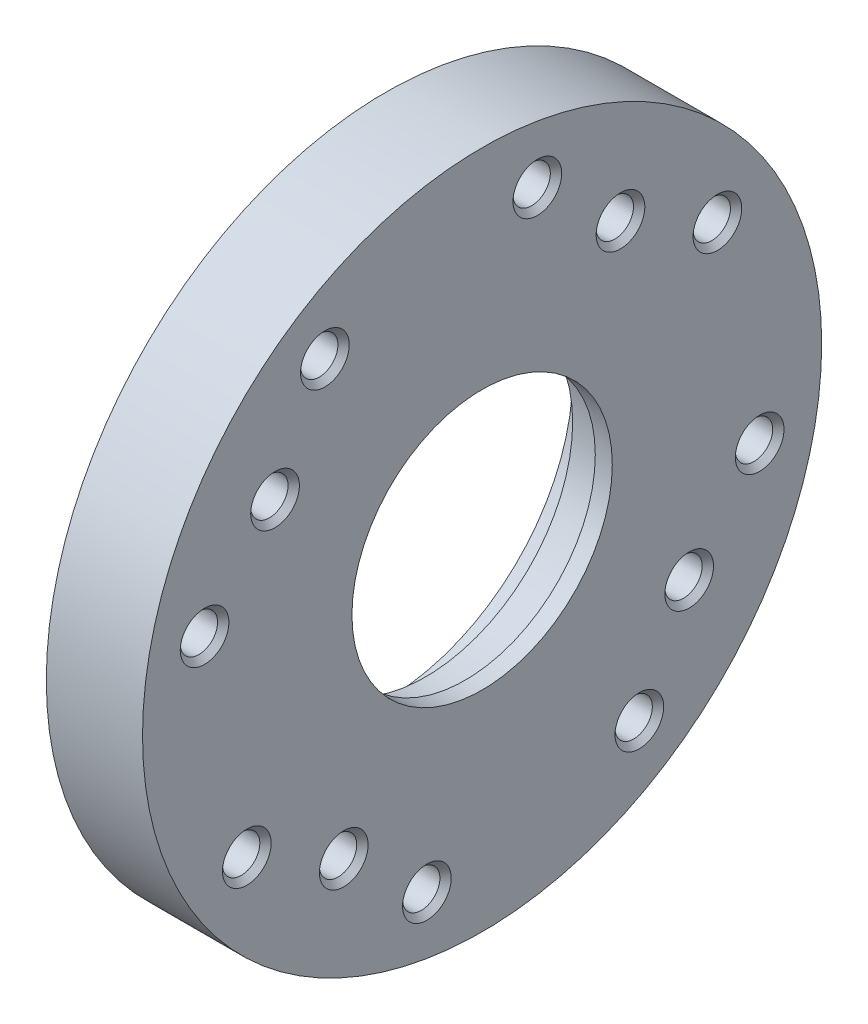
from build123d import *

# Parameters (mm, degrees)
SKETCH2_R          = 2.5
CUT_EXTRUDE1_DEPTH = 4
SKETCH3_R          = 3
CUT_EXTRUDE4_DEPTH = 87.539008545
SKETCH5_R          = 3.3
CUT_EXTRUDE6_DEPTH = 10
CHAMFER1_SIZE      = 1


with BuildPart() as part:
    # Sketch1 → Revolve1 (revolve)
    with BuildSketch(Plane.XY):
        Polygon((0, 60), (0, 33), (7, 33), (7, 26), (14, 26), (14, 23), (17, 23), (17, 60), align=None)
    revolve(axis=Axis((0, 0, 0), (1, 0, 0)))

    # Sketch2 → Cut-Extrude1 (cut)
    with BuildSketch(Plane.ZY):
        with Locations((0, 40)):
            Circle(SKETCH2_R)
        with Locations((15.307337295, 36.9551813)):
            Circle(SKETCH2_R)
        with Locations((28.284271247, 28.284271247)):
            Circle(SKETCH2_R)
        with Locations((36.9551813, 15.307337295)):
            Circle(SKETCH2_R)
        with Locations((40, 0)):
            Circle(SKETCH2_R)
        with Locations((36.9551813, -15.307337295)):
            Circle(SKETCH2_R)
        with Locations((28.284271247, -28.284271247)):
            Circle(SKETCH2_R)
        with Locations((15.307337295, -36.9551813)):
            Circle(SKETCH2_R)
        with Locations((0, -40)):
            Circle(SKETCH2_R)
        with Locations((-15.307337295, -36.9551813)):
            Circle(SKETCH2_R)
        with Locations((-28.284271247, -28.284271247)):
            Circle(SKETCH2_R)
        with Locations((-36.9551813, -15.307337295)):
            Circle(SKETCH2_R)
        with Locations((-40, 0)):
            Circle(SKETCH2_R)
        with Locations((-36.9551813, 15.307337295)):
            Circle(SKETCH2_R)
        with Locations((-28.284271247, 28.284271247)):
            Circle(SKETCH2_R)
        with Locations((-15.307337295, 36.9551813)):
            Circle(SKETCH2_R)
    extrude(amount=-CUT_EXTRUDE1_DEPTH, mode=Mode.SUBTRACT)

    # Sketch3 → Cut-Extrude4 (cut, through all)
    with BuildSketch(Plane(origin=(17, 0, 0), x_dir=(0, 0, -1), z_dir=(1, 0, 0))):
        with Locations((49.03926402, -9.754516101)):
            Circle(SKETCH3_R)
        with Locations((27.778511651, -41.573480615)):
            Circle(SKETCH3_R)
        with Locations((-9.754516101, -49.03926402)):
            Circle(SKETCH3_R)
        with Locations((-41.573480615, -27.778511651)):
            Circle(SKETCH3_R)
        with Locations((-49.03926402, 9.754516101)):
            Circle(SKETCH3_R)
        with Locations((-27.778511651, 41.573480615)):
            Circle(SKETCH3_R)
        with Locations((9.754516101, 49.03926402)):
            Circle(SKETCH3_R)
        with Locations((41.573480615, 27.778511651)):
            Circle(SKETCH3_R)
    extrude(amount=-CUT_EXTRUDE4_DEPTH, mode=Mode.SUBTRACT)

    # Sketch5 → Cut-Extrude6 (cut)
    with BuildSketch(Plane(origin=(17, 0, 0), x_dir=(0, 0, -1), z_dir=(1, 0, 0))):
        with Locations((9.754516101, 49.03926402)):
            Circle(SKETCH5_R)
        with Locations((41.573480615, 27.778511651)):
            Circle(SKETCH5_R)
        with Locations((49.03926402, -9.754516101)):
            Circle(SKETCH5_R)
        with Locations((27.778511651, -41.573480615)):
            Circle(SKETCH5_R)
        with Locations((-9.754516101, -49.03926402)):
            Circle(SKETCH5_R)
        with Locations((-41.573480615, -27.778511651)):
            Circle(SKETCH5_R)
        with Locations((-49.03926402, 9.754516101)):
            Circle(SKETCH5_R)
        with Locations((-27.778511651, 41.573480615)):
            Circle(SKETCH5_R)
        with Locations((24.445090253, 36.584662941)):
            Circle(SKETCH5_R)
        with Locations((36.584662941, -24.445090253)):
            Circle(SKETCH5_R)
        with Locations((-24.445090253, -36.584662941)):
            Circle(SKETCH5_R)
        with Locations((-36.584662941, 24.445090253)):
            Circle(SKETCH5_R)
    extrude(amount=-CUT_EXTRUDE6_DEPTH, mode=Mode.SUBTRACT)

    # Chamfer1
    chamfer1_edges = [part.edges().sort_by_distance(p)[0] for p in [
        (17, -27.778511651, 44.873480615),
        (17, -36.584662941, 27.745090253),
        (17, -49.03926402, 13.054516101),
        (17, -41.573480615, -24.478511651),
        (17, -24.445090253, -33.284662941),
        (17, -9.754516101, -45.73926402),
        (17, 27.778511651, -38.273480615),
        (17, 36.584662941, -21.145090253),
        (17, 49.03926402, -6.454516101),
        (17, 41.573480615, 31.078511651),
        (17, 24.445090253, 39.884662941),
        (17, 9.754516101, 52.33926402),
    ]]
    chamfer(chamfer1_edges, length=CHAMFER1_SIZE)


solid = part.part
